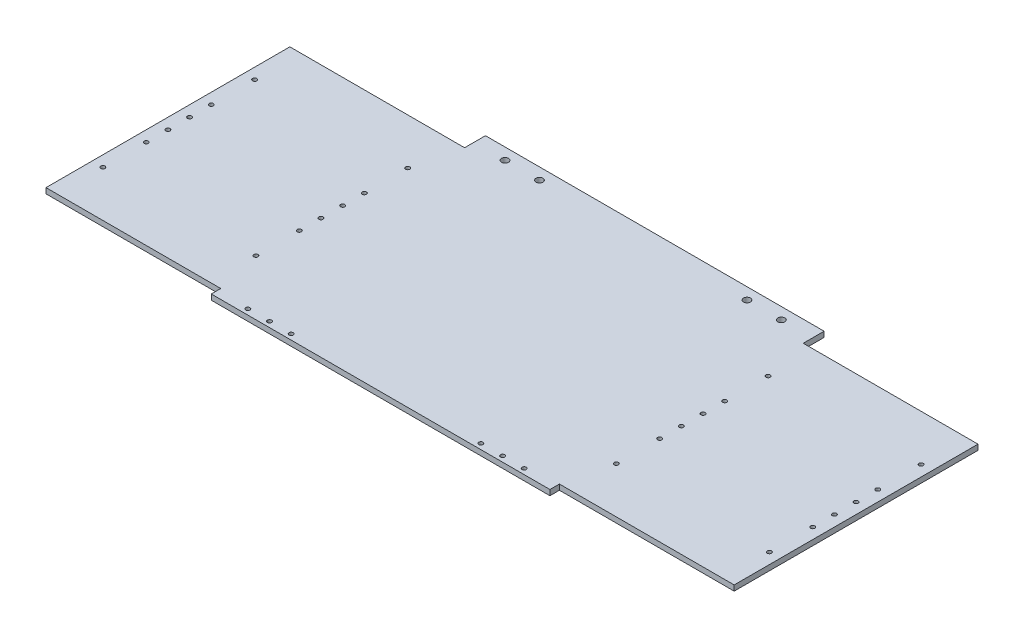
from build123d import *

# Parameters (mm, degrees)
SKETCH1_R           = 2.564
SKETCH1_R_2         = 1.55
BOSS_EXTRUDE1_DEPTH = 4


with BuildPart() as part:
    # Sketch1 → Boss-Extrude1 (new body)
    with BuildSketch(Plane(origin=(0, 0, 0), x_dir=(1, 0, 0), z_dir=(0, 1, 0))):
        Polygon((129, 0), (129, -7), (379, -7), (379, 0), (508, 0), (508, 180), (379, 180), (379, 195.398), (129, 195.398), (129, 180), (0, 180), (0, 0), align=None)
        with Locations((152, 186.858)):
            Circle(SKETCH1_R, mode=Mode.SUBTRACT)
        with Locations((177.4, 186.858)):
            Circle(SKETCH1_R, mode=Mode.SUBTRACT)
        with Locations((152, -3)):
            Circle(SKETCH1_R_2, mode=Mode.SUBTRACT)
        with Locations((184, -3)):
            Circle(SKETCH1_R_2, mode=Mode.SUBTRACT)
        with Locations((330.6, 186.858)):
            Circle(SKETCH1_R, mode=Mode.SUBTRACT)
        with Locations((356, 186.858)):
            Circle(SKETCH1_R, mode=Mode.SUBTRACT)
        with Locations((168, -3)):
            Circle(SKETCH1_R_2, mode=Mode.SUBTRACT)
        with Locations((324, -3)):
            Circle(SKETCH1_R_2, mode=Mode.SUBTRACT)
        with Locations((340, -3)):
            Circle(SKETCH1_R_2, mode=Mode.SUBTRACT)
        with Locations((356, -3)):
            Circle(SKETCH1_R_2, mode=Mode.SUBTRACT)
        with Locations((121, 146)):
            Circle(SKETCH1_R_2, mode=Mode.SUBTRACT)
        with Locations((121, 114)):
            Circle(SKETCH1_R_2, mode=Mode.SUBTRACT)
        with Locations((121, 98)):
            Circle(SKETCH1_R_2, mode=Mode.SUBTRACT)
        with Locations((121, 82)):
            Circle(SKETCH1_R_2, mode=Mode.SUBTRACT)
        with Locations((121, 66)):
            Circle(SKETCH1_R_2, mode=Mode.SUBTRACT)
        with Locations((121, 34)):
            Circle(SKETCH1_R_2, mode=Mode.SUBTRACT)
        with Locations((387, 146)):
            Circle(SKETCH1_R_2, mode=Mode.SUBTRACT)
        with Locations((387, 114)):
            Circle(SKETCH1_R_2, mode=Mode.SUBTRACT)
        with Locations((387, 98)):
            Circle(SKETCH1_R_2, mode=Mode.SUBTRACT)
        with Locations((387, 82)):
            Circle(SKETCH1_R_2, mode=Mode.SUBTRACT)
        with Locations((387, 66)):
            Circle(SKETCH1_R_2, mode=Mode.SUBTRACT)
        with Locations((387, 34)):
            Circle(SKETCH1_R_2, mode=Mode.SUBTRACT)
        with Locations((8, 146)):
            Circle(SKETCH1_R_2, mode=Mode.SUBTRACT)
        with Locations((8, 114)):
            Circle(SKETCH1_R_2, mode=Mode.SUBTRACT)
        with Locations((8, 98)):
            Circle(SKETCH1_R_2, mode=Mode.SUBTRACT)
        with Locations((8, 82)):
            Circle(SKETCH1_R_2, mode=Mode.SUBTRACT)
        with Locations((8, 66)):
            Circle(SKETCH1_R_2, mode=Mode.SUBTRACT)
        with Locations((8, 34)):
            Circle(SKETCH1_R_2, mode=Mode.SUBTRACT)
        with Locations((500, 34)):
            Circle(SKETCH1_R_2, mode=Mode.SUBTRACT)
        with Locations((500, 66)):
            Circle(SKETCH1_R_2, mode=Mode.SUBTRACT)
        with Locations((500, 82)):
            Circle(SKETCH1_R_2, mode=Mode.SUBTRACT)
        with Locations((500, 98)):
            Circle(SKETCH1_R_2, mode=Mode.SUBTRACT)
        with Locations((500, 114)):
            Circle(SKETCH1_R_2, mode=Mode.SUBTRACT)
        with Locations((500, 146)):
            Circle(SKETCH1_R_2, mode=Mode.SUBTRACT)
    extrude(amount=BOSS_EXTRUDE1_DEPTH)


solid = part.part
